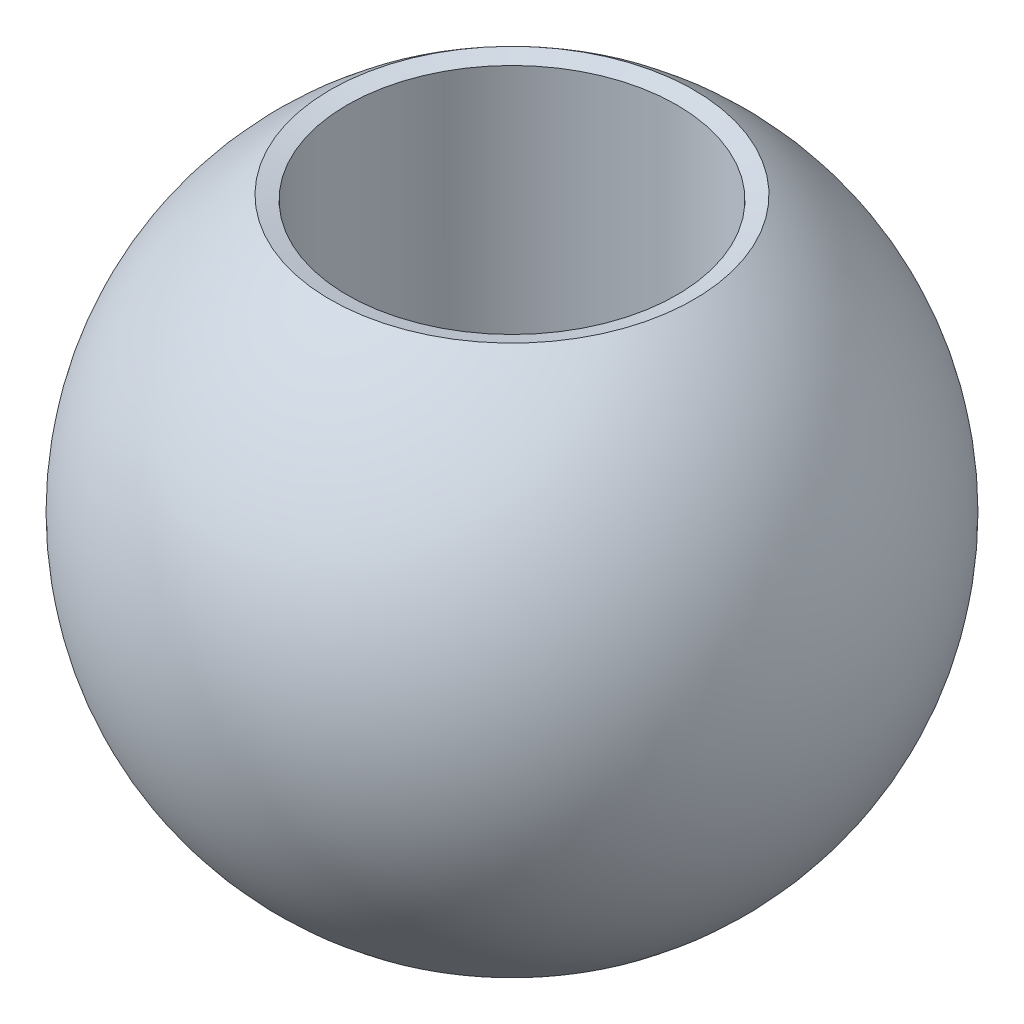
from build123d import *

# Parameters (mm, degrees)
CORTAR_EXTRUIR1_DEPTH      = 10
CORTAR_EXTRUIR1_DEPTH_BACK = 10
CROQUIS3_R                 = 4
CHAFL_N1_SIZE              = 0.366025404


with BuildPart() as part:
    # Croquis1 → Revolución1 (revolve)
    with BuildSketch(Plane.XY):
        with BuildLine():
            Line((0, 0), (0, -8))
            ThreePointArc((0, -8), (8, 0), (0, 8))
            Line((0, 8), (0, 0))
        make_face()
    revolve(axis=Axis((0, -8, 0), (0, 1, 0)))

    # Croquis3 → Cortar-Extruir1 (cut, two sides: drawn at the far end of the back side and taken through both)
    with BuildSketch(Plane(origin=(0, 0, 0), x_dir=(1, 0, 0), z_dir=(0, 1, 0)).offset(-CORTAR_EXTRUIR1_DEPTH_BACK)):
        with Locations(Location((0, 0, 0), (0, 0, 180))):
            Circle(CROQUIS3_R)
    extrude(amount=CORTAR_EXTRUIR1_DEPTH + CORTAR_EXTRUIR1_DEPTH_BACK, mode=Mode.SUBTRACT)

    # Chaflán1
    # the kernel refuses this chamfer: 0.5, 0.366025404 mm, written as the material it takes off along each edge
    with BuildSketch(Plane(origin=(0, -6.92820323, 0), x_dir=(-1, 0, 0), z_dir=(0, 0, -1))) as chafl_n1_piece_1:
        with BuildLine():
            Line((4.412889217, 0.255392072), (4, CHAFL_N1_SIZE))
            Line((4, CHAFL_N1_SIZE), (4, 0))
            ThreePointArc((4, 0), (4.214206629, 0.128169224), (4.412889217, 0.255392072))
        make_face()
    revolve(axis=Axis((0, -6.92820323, 0), (0, 1, 0)), revolution_arc=180, mode=Mode.SUBTRACT)
    with BuildSketch(Plane(origin=(0, 6.92820323, 0), x_dir=(-1, 0, 0), z_dir=(0, 0, 1))) as chafl_n1_piece_2:
        with BuildLine():
            Line((4.412889217, 0.255392072), (4, CHAFL_N1_SIZE))
            Line((4, CHAFL_N1_SIZE), (4, 0))
            ThreePointArc((4, 0), (4.214206629, 0.128169224), (4.412889217, 0.255392072))
        make_face()
    revolve(axis=Axis((0, 6.92820323, 0), (0, -1, 0)), revolution_arc=180, mode=Mode.SUBTRACT)
    with BuildSketch(Plane(origin=(0, 6.92820323, 0), x_dir=(1, 0, 0), z_dir=(0, 0, -1))) as chafl_n1_piece_3:
        with BuildLine():
            Line((4.412889217, 0.255392072), (4, CHAFL_N1_SIZE))
            Line((4, CHAFL_N1_SIZE), (4, 0))
            ThreePointArc((4, 0), (4.214206629, 0.128169224), (4.412889217, 0.255392072))
        make_face()
    revolve(axis=Axis((0, 6.92820323, 0), (0, -1, 0)), revolution_arc=180, mode=Mode.SUBTRACT)
    with BuildSketch(Plane(origin=(0, -6.92820323, 0), x_dir=(1, 0, 0), z_dir=(0, 0, 1))) as chafl_n1_piece_4:
        with BuildLine():
            Line((4.412889217, 0.255392072), (4, CHAFL_N1_SIZE))
            Line((4, CHAFL_N1_SIZE), (4, 0))
            ThreePointArc((4, 0), (4.214206629, 0.128169224), (4.412889217, 0.255392072))
        make_face()
    revolve(axis=Axis((0, -6.92820323, 0), (0, 1, 0)), revolution_arc=180, mode=Mode.SUBTRACT)


solid = part.part
